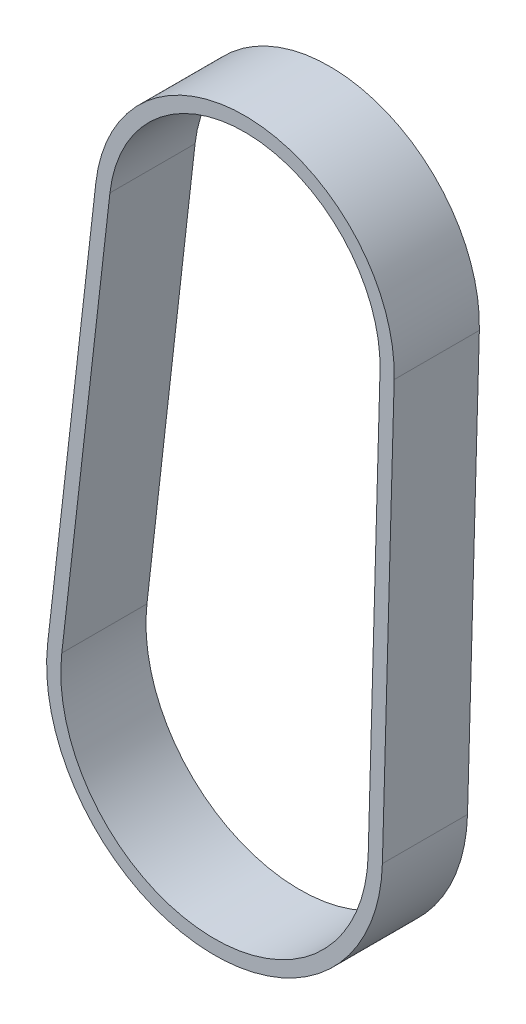
from build123d import *

# Parameters (mm, degrees)
EXTRUDE_THIN1_DEPTH = 9


with BuildPart() as part:
    # Sketch2 → Extrude-Thin1 (new body)
    with BuildSketch(Plane.XY):
        with BuildLine():
            Line((15.817830617, -0.439847812), (14.56814143, -45.381237347))
            ThreePointArc((14.56814143, -45.381237347), (-4.427361271, -62.593616602), (-20.81093643, -42.8788103))
            Line((-20.81093643, -42.8788103), (-15.72225828, 1.791040506))
            ThreePointArc((-15.72225828, 1.791040506), (1.116467281, 15.784509252), (15.817830617, -0.439847812))
        make_face()
        with BuildLine():
            Line((14.318410206, -0.398153297), (13.06872102, -45.339542831))
            ThreePointArc((13.06872102, -45.339542831), (-4.321527932, -61.097354825), (-19.320575613, -43.048588493))
            Line((-19.320575613, -43.048588493), (-14.231897463, 1.621262313))
            ThreePointArc((-14.231897463, 1.621262313), (1.010633942, 14.288247475), (14.318410206, -0.398153297))
        make_face(mode=Mode.SUBTRACT)
    extrude(amount=EXTRUDE_THIN1_DEPTH)


solid = part.part
